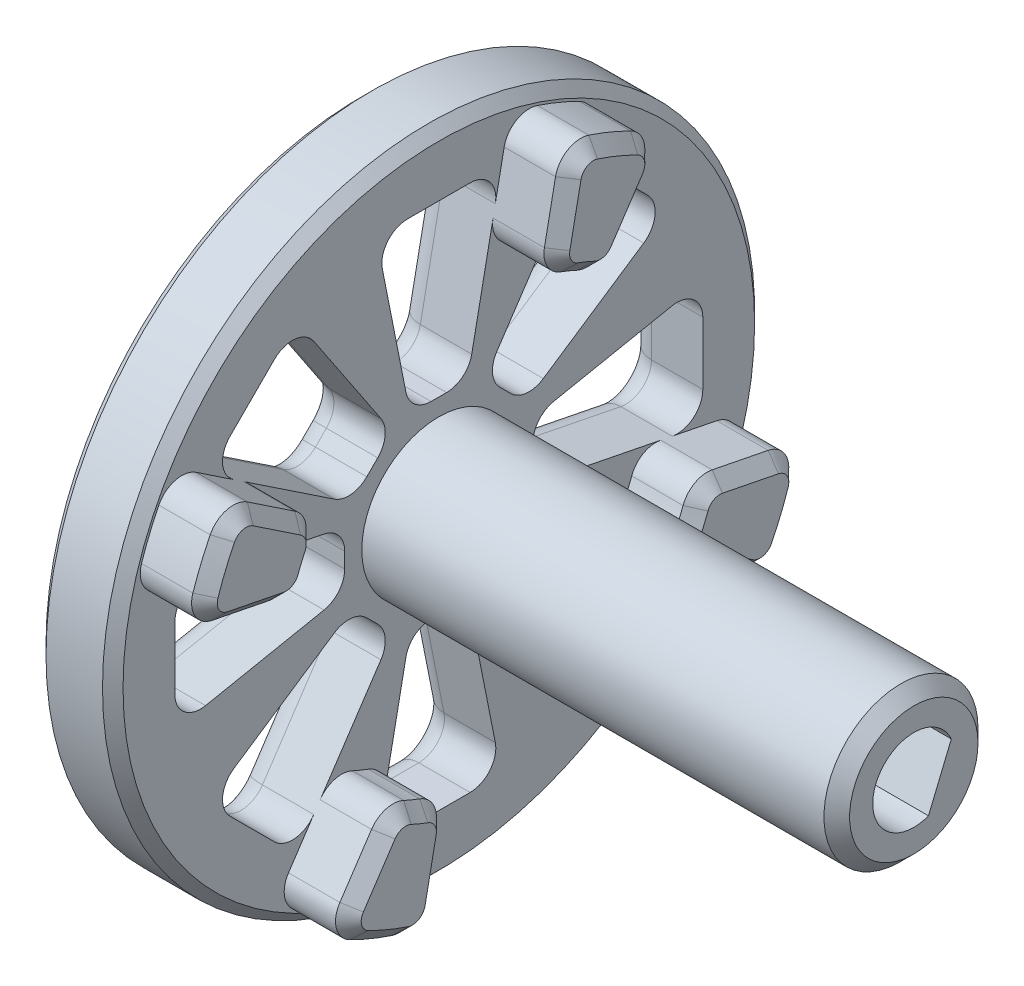
from build123d import *

# Parameters (mm, degrees)
BOSS_EXTRUDE1_DEPTH          = 17.5
BOSS_EXTRUDE1_DEPTH_BACK     = 1.5
SKETCH2_R                    = 3
CUT_EXTRUDE_468_DEPTH        = 10
CHAMFER1_SIZE                = 0.5
SKETCH4_R                    = 12.7
EXTRUDE_692_DEPTH            = 3
CHAMFER2_SIZE                = 0.4
CUT_EXTRUDE6_REACH           = 30.015
CIRPATTERN1_COUNT            = 8
FILLET1_R                    = 1
BOSS_EXTRUDE7_DEPTH          = 2.5
CHAMFER4_SIZE                = 0.5
CIRPATTERN4_COUNT            = 4
CHAMFER4_OF_CIRPATTERN4_SIZE = 0.5


with BuildPart() as part:
    # Sketch2 → Boss-Extrude1 (new, two sides: drawn at the far end of the back side and taken through both)
    with BuildSketch(Plane(origin=(0, 0, 0), x_dir=(0, 0, -1), z_dir=(1, 0, 0)).offset(-BOSS_EXTRUDE1_DEPTH_BACK)):
        Circle(SKETCH2_R)
    extrude(amount=BOSS_EXTRUDE1_DEPTH + BOSS_EXTRUDE1_DEPTH_BACK)

    # Sketch1 → Cut-Extrude 468 (cut)
    with BuildSketch(Plane(origin=(17.5, 0, 0), x_dir=(0, 0, -1), z_dir=(1, 0, 0))):
        with BuildLine():
            Line((1.460905454, 0.652499237), (0.571629518, -1.494402789))
            ThreePointArc((0.571629518, -1.494402789), (-1.478207252, 0.612293492), (1.460905454, 0.652499237))
        make_face()
    extrude(amount=-CUT_EXTRUDE_468_DEPTH, mode=Mode.SUBTRACT)

    # Chamfer1
    chamfer1_edges = [part.edges().sort_by_distance(p)[0] for p in [
        (17.5, 0, 3),
    ]]
    chamfer(chamfer1_edges, length=CHAMFER1_SIZE)

    # Sketch4 → Extrude 692 (add)
    with BuildSketch(Plane.ZY.offset(1)):
        Circle(SKETCH4_R)
    extrude(amount=EXTRUDE_692_DEPTH)

    # Chamfer2
    chamfer2_edges = [part.edges().sort_by_distance(p)[0] for p in [
        (-1, 0, -12.7),
        (-4, 0, -12.7),
    ]]
    chamfer(chamfer2_edges, length=CHAMFER2_SIZE)

    # Sketch6 → Cut-Extrude6 (cut, up to next)
    with BuildSketch(Plane.ZY.offset(4), mode=Mode.PRIVATE) as cut_extrude6_sk1:
        with BuildLine():
            Line((-0.301146321, 3.666270684), (0.301146321, 3.666270684))
            ThreePointArc((0.301146321, 3.666270684), (0.935539605, 3.893260231), (1.281931602, 4.471180362))
            Line((1.281931602, 4.471180362), (2.20002588, 9.086751984))
            ThreePointArc((2.20002588, 9.086751984), (1.992251053, 9.91623559), (1.219240599, 10.281842306))
            Line((1.219240599, 10.281842306), (-1.219240599, 10.281842306))
            ThreePointArc((-1.219240599, 10.281842306), (-1.992251053, 9.91623559), (-2.20002588, 9.086751984))
            Line((-2.20002588, 9.086751984), (-1.281931602, 4.471180362))
            ThreePointArc((-1.281931602, 4.471180362), (-0.935539605, 3.893260231), (-0.301146321, 3.666270684))
        make_face()
    cut_extrude6_tool1 = extrude(cut_extrude6_sk1.sketch, amount=-CUT_EXTRUDE6_REACH, mode=Mode.PRIVATE) & part.part
    cut_extrude6 = cut_extrude6_tool1.solids().sort_by_distance((-4, 7.345701, 0))[0]
    add(cut_extrude6, mode=Mode.SUBTRACT)

    # CirPattern1: Cut-Extrude6 ×8 about axis
    cirpattern1_axis = Axis((0, 0, 0), (1, 0, 0))
    for i in range(1, CIRPATTERN1_COUNT):
        add(cut_extrude6.rotate(cirpattern1_axis, i * 360 / CIRPATTERN1_COUNT), mode=Mode.SUBTRACT)

    # Fillet1
    # the kernel refuses this fillet: 1 mm, written as the material it takes off along each edge
    with BuildSketch(Plane(origin=(-4, -9.281842306, -1.219240599), x_dir=(0, 0.1950903220161297, -0.9807852804032302), z_dir=(0, 0.9807852804032302, 0.1950903220161297))) as fillet1_piece_1:
        with BuildLine():
            CenterArc((1 + FILLET1_R, -FILLET1_R), FILLET1_R, 90, 90)
            Line((1 + FILLET1_R, 0), (1, 0))
            Line((1, 0), (1, -FILLET1_R))
        make_face()
    revolve(axis=Axis((-4, -9.281842306, -1.219240599), (-1, 0, 0)), revolution_arc=101.25, mode=Mode.SUBTRACT)
    with BuildSketch(Plane(origin=(-4, -10.281842306, -1.219240599), x_dir=(1, 0, 0), z_dir=(0, 0, 1)), Plane(origin=(-4, -8.132493713, 6.408227122), x_dir=(1, 0, 0), z_dir=(0, 0.7071067811865476, 0.7071067811865475)), Plane(origin=(-4, 1.219240599, -10.281842306), x_dir=(1, 0, 0), z_dir=(0, -1, 0)), Plane(origin=(-4, -6.408227122, -8.132493713), x_dir=(1, 0, 0), z_dir=(0, -0.7071067811865475, 0.7071067811865477)), Plane(origin=(-4, 6.408227122, 8.132493713), x_dir=(1, 0, 0), z_dir=(0, 0.7071067811865475, -0.7071067811865476)), Plane(origin=(-4, -1.219240599, 10.281842306), x_dir=(1, 0, 0), z_dir=(0, 1, 0)), Plane(origin=(-4, 8.132493713, -6.408227122), x_dir=(1, 0, 0), z_dir=(0, -0.7071067811865477, -0.7071067811865474)), Plane(origin=(-4, 10.281842306, 1.219240599), x_dir=(1, 0, 0), z_dir=(0, 0, -1))) as fillet1_piece_2:
        with BuildLine():
            CenterArc((FILLET1_R, -FILLET1_R), FILLET1_R, 90, 90)
            Line((0, -FILLET1_R), (0, 0))
            Line((0, 0), (FILLET1_R, 0))
        make_face()
    extrude(amount=2.438481198, mode=Mode.SUBTRACT)
    with BuildSketch(Plane(origin=(-4, -9.281842306, 1.219240599), x_dir=(0, -1, 0), z_dir=(0, 0, -1))) as fillet1_piece_3:
        with BuildLine():
            CenterArc((1 + FILLET1_R, -FILLET1_R), FILLET1_R, 90, 90)
            Line((1 + FILLET1_R, 0), (1, 0))
            Line((1, 0), (1, -FILLET1_R))
        make_face()
    revolve(axis=Axis((-4, -9.281842306, 1.219240599), (-1, 0, 0)), revolution_arc=101.25, mode=Mode.SUBTRACT)
    with BuildSketch(Plane(origin=(-4, -9.086751984, 2.20002588), x_dir=(1, 0, 0), z_dir=(0, 0.9807852804032319, -0.19509032201612145)), Plane(origin=(-4, -4.471180362, -1.281931602), x_dir=(1, 0, 0), z_dir=(0, -0.9807852804032319, -0.1950903220161212)), Plane(origin=(-4, -4.869650728, 7.980957165), x_dir=(1, 0, 0), z_dir=(0, 0.5555702330196081, -0.8314696123025413)), Plane(origin=(-4, -4.068064482, 2.255139425), x_dir=(1, 0, 0), z_dir=(0, -0.8314696123025412, 0.5555702330196082)), Plane(origin=(-4, -2.20002588, -9.086751984), x_dir=(1, 0, 0), z_dir=(0, 0.19509032201612156, 0.9807852804032319)), Plane(origin=(-4, 1.281931602, -4.471180362), x_dir=(1, 0, 0), z_dir=(0, 0.1950903220161211, -0.9807852804032319)), Plane(origin=(-4, -7.980957165, -4.869650728), x_dir=(1, 0, 0), z_dir=(0, 0.8314696123025415, 0.555570233019608)), Plane(origin=(-4, -2.255139425, -4.068064482), x_dir=(1, 0, 0), z_dir=(0, -0.5555702330196083, -0.8314696123025412)), Plane(origin=(-4, 7.980957165, 4.869650728), x_dir=(1, 0, 0), z_dir=(0, -0.8314696123025413, -0.5555702330196081)), Plane(origin=(-4, 2.255139425, 4.068064482), x_dir=(1, 0, 0), z_dir=(0, 0.5555702330196082, 0.8314696123025412)), Plane(origin=(-4, 2.20002588, 9.086751984), x_dir=(1, 0, 0), z_dir=(0, -0.19509032201612145, -0.9807852804032319)), Plane(origin=(-4, -1.281931602, 4.471180362), x_dir=(1, 0, 0), z_dir=(0, -0.1950903220161212, 0.9807852804032319)), Plane(origin=(-4, 4.869650728, -7.980957165), x_dir=(1, 0, 0), z_dir=(0, -0.555570233019608, 0.8314696123025415)), Plane(origin=(-4, 4.068064482, -2.255139425), x_dir=(1, 0, 0), z_dir=(0, 0.8314696123025412, -0.5555702330196084)), Plane(origin=(-4, 9.086751984, -2.20002588), x_dir=(1, 0, 0), z_dir=(0, -0.9807852804032319, 0.19509032201612134)), Plane(origin=(-4, 4.471180362, 1.281931602), x_dir=(1, 0, 0), z_dir=(0, 0.9807852804032319, 0.1950903220161213))) as fillet1_piece_4:
        with BuildLine():
            CenterArc((FILLET1_R, -FILLET1_R), FILLET1_R, 90, 90)
            Line((0, -FILLET1_R), (0, 0))
            Line((0, 0), (FILLET1_R, 0))
        make_face()
    extrude(amount=4.705996015, mode=Mode.SUBTRACT)
    with BuildSketch(Plane(origin=(-4, -4.666270684, 0.301146321), x_dir=(0, 0.1950903220161148, 0.9807852804032332), z_dir=(0, -0.9807852804032332, 0.1950903220161148))) as fillet1_piece_5:
        with BuildLine():
            CenterArc((1 + FILLET1_R, -FILLET1_R), FILLET1_R, 90, 90)
            Line((1 + FILLET1_R, 0), (1, 0))
            Line((1, 0), (1, -FILLET1_R))
        make_face()
    revolve(axis=Axis((-4, -4.666270684, 0.301146321), (-1, 0, 0)), revolution_arc=78.75, mode=Mode.SUBTRACT)
    with BuildSketch(Plane(origin=(-4, -3.666270684, 0.301146321), x_dir=(1, 0, 0), z_dir=(0, 0, -1)), Plane(origin=(-4, -2.379502257, 2.805387468), x_dir=(1, 0, 0), z_dir=(0, -0.7071067811865476, -0.7071067811865475)), Plane(origin=(-4, -0.301146321, -3.666270684), x_dir=(1, 0, 0), z_dir=(0, 1, 0)), Plane(origin=(-4, -2.805387468, -2.379502257), x_dir=(1, 0, 0), z_dir=(0, 0.7071067811865475, -0.7071067811865477)), Plane(origin=(-4, 2.805387468, 2.379502257), x_dir=(1, 0, 0), z_dir=(0, -0.7071067811865475, 0.7071067811865476)), Plane(origin=(-4, 0.301146321, 3.666270684), x_dir=(1, 0, 0), z_dir=(0, -1, 0)), Plane(origin=(-4, 2.379502257, -2.805387468), x_dir=(1, 0, 0), z_dir=(0, 0.7071067811865477, 0.7071067811865474)), Plane(origin=(-4, 3.666270684, -0.301146321), x_dir=(1, 0, 0), z_dir=(0, 0, 1))) as fillet1_piece_6:
        with BuildLine():
            CenterArc((FILLET1_R, -FILLET1_R), FILLET1_R, 90, 90)
            Line((0, -FILLET1_R), (0, 0))
            Line((0, 0), (FILLET1_R, 0))
        make_face()
    extrude(amount=0.602292642, mode=Mode.SUBTRACT)
    with BuildSketch(Plane(origin=(-4, -4.666270684, -0.301146321), x_dir=(0, 1, 0), z_dir=(0, 0, 1))) as fillet1_piece_7:
        with BuildLine():
            CenterArc((1 + FILLET1_R, -FILLET1_R), FILLET1_R, 90, 90)
            Line((1 + FILLET1_R, 0), (1, 0))
            Line((1, 0), (1, -FILLET1_R))
        make_face()
    revolve(axis=Axis((-4, -4.666270684, -0.301146321), (-1, 0, 0)), revolution_arc=78.75, mode=Mode.SUBTRACT)
    with BuildSketch(Plane(origin=(-4, -7.425386932, 5.701120341), x_dir=(0, -0.5555702330196015, -0.8314696123025458), z_dir=(0, 0.8314696123025458, -0.5555702330196015))) as fillet1_piece_8:
        with BuildLine():
            CenterArc((1 + FILLET1_R, -FILLET1_R), FILLET1_R, 90, 90)
            Line((1 + FILLET1_R, 0), (1, 0))
            Line((1, 0), (1, -FILLET1_R))
        make_face()
    revolve(axis=Axis((-4, -7.425386932, 5.701120341), (-1, 0, 0)), revolution_arc=101.25, mode=Mode.SUBTRACT)
    with BuildSketch(Plane(origin=(-4, -5.701120341, 7.425386932), x_dir=(0, -0.7071067811865542, 0.7071067811865409), z_dir=(0, -0.7071067811865409, -0.7071067811865542))) as fillet1_piece_9:
        with BuildLine():
            CenterArc((1 + FILLET1_R, -FILLET1_R), FILLET1_R, 90, 90)
            Line((1 + FILLET1_R, 0), (1, 0))
            Line((1, 0), (1, -FILLET1_R))
        make_face()
    revolve(axis=Axis((-4, -5.701120341, 7.425386932), (-1, 0, 0)), revolution_arc=101.25, mode=Mode.SUBTRACT)
    with BuildSketch(Plane(origin=(-4, -3.086609038, 3.512494249), x_dir=(0, 0.8314696123025379, 0.5555702330196132), z_dir=(0, -0.5555702330196132, 0.8314696123025379))) as fillet1_piece_10:
        with BuildLine():
            CenterArc((1 + FILLET1_R, -FILLET1_R), FILLET1_R, 90, 90)
            Line((1 + FILLET1_R, 0), (1, 0))
            Line((1, 0), (1, -FILLET1_R))
        make_face()
    revolve(axis=Axis((-4, -3.086609038, 3.512494249), (-1, 0, 0)), revolution_arc=78.75, mode=Mode.SUBTRACT)
    with BuildSketch(Plane(origin=(-4, -3.512494249, 3.086609038), x_dir=(0, 0.7071067811865516, -0.7071067811865436), z_dir=(0, 0.7071067811865436, 0.7071067811865516))) as fillet1_piece_11:
        with BuildLine():
            CenterArc((1 + FILLET1_R, -FILLET1_R), FILLET1_R, 90, 90)
            Line((1 + FILLET1_R, 0), (1, 0))
            Line((1, 0), (1, -FILLET1_R))
        make_face()
    revolve(axis=Axis((-4, -3.512494249, 3.086609038), (-1, 0, 0)), revolution_arc=78.75, mode=Mode.SUBTRACT)
    with BuildSketch(Plane(origin=(-4, 1.219240599, -9.281842306), x_dir=(0, 0.9807852804032302, 0.19509032201612966), z_dir=(0, -0.19509032201612966, 0.9807852804032302))) as fillet1_piece_12:
        with BuildLine():
            CenterArc((1 + FILLET1_R, -FILLET1_R), FILLET1_R, 90, 90)
            Line((1 + FILLET1_R, 0), (1, 0))
            Line((1, 0), (1, -FILLET1_R))
        make_face()
    revolve(axis=Axis((-4, 1.219240599, -9.281842306), (-1, 0, 0)), revolution_arc=101.25, mode=Mode.SUBTRACT)
    with BuildSketch(Plane(origin=(-4, -1.219240599, -9.281842306), x_dir=(0, 0, -1), z_dir=(0, 1, 0))) as fillet1_piece_13:
        with BuildLine():
            CenterArc((1 + FILLET1_R, -FILLET1_R), FILLET1_R, 90, 90)
            Line((1 + FILLET1_R, 0), (1, 0))
            Line((1, 0), (1, -FILLET1_R))
        make_face()
    revolve(axis=Axis((-4, -1.219240599, -9.281842306), (-1, 0, 0)), revolution_arc=101.25, mode=Mode.SUBTRACT)
    with BuildSketch(Plane(origin=(-4, -0.301146321, -4.666270684), x_dir=(0, -0.9807852804032332, 0.1950903220161148), z_dir=(0, -0.1950903220161148, -0.9807852804032332))) as fillet1_piece_14:
        with BuildLine():
            CenterArc((1 + FILLET1_R, -FILLET1_R), FILLET1_R, 90, 90)
            Line((1 + FILLET1_R, 0), (1, 0))
            Line((1, 0), (1, -FILLET1_R))
        make_face()
    revolve(axis=Axis((-4, -0.301146321, -4.666270684), (-1, 0, 0)), revolution_arc=78.75, mode=Mode.SUBTRACT)
    with BuildSketch(Plane(origin=(-4, 0.301146321, -4.666270684), x_dir=(0, 0, 1), z_dir=(0, -1, 0))) as fillet1_piece_15:
        with BuildLine():
            CenterArc((1 + FILLET1_R, -FILLET1_R), FILLET1_R, 90, 90)
            Line((1 + FILLET1_R, 0), (1, 0))
            Line((1, 0), (1, -FILLET1_R))
        make_face()
    revolve(axis=Axis((-4, 0.301146321, -4.666270684), (-1, 0, 0)), revolution_arc=78.75, mode=Mode.SUBTRACT)
    with BuildSketch(Plane(origin=(-4, -5.701120341, -7.425386932), x_dir=(0, 0.8314696123025458, -0.5555702330196015), z_dir=(0, 0.5555702330196015, 0.8314696123025458))) as fillet1_piece_16:
        with BuildLine():
            CenterArc((1 + FILLET1_R, -FILLET1_R), FILLET1_R, 90, 90)
            Line((1 + FILLET1_R, 0), (1, 0))
            Line((1, 0), (1, -FILLET1_R))
        make_face()
    revolve(axis=Axis((-4, -5.701120341, -7.425386932), (-1, 0, 0)), revolution_arc=101.25, mode=Mode.SUBTRACT)
    with BuildSketch(Plane(origin=(-4, -7.425386932, -5.701120341), x_dir=(0, -0.7071067811865414, -0.7071067811865538), z_dir=(0, 0.7071067811865538, -0.7071067811865414))) as fillet1_piece_17:
        with BuildLine():
            CenterArc((1 + FILLET1_R, -FILLET1_R), FILLET1_R, 90, 90)
            Line((1 + FILLET1_R, 0), (1, 0))
            Line((1, 0), (1, -FILLET1_R))
        make_face()
    revolve(axis=Axis((-4, -7.425386932, -5.701120341), (-1, 0, 0)), revolution_arc=101.25, mode=Mode.SUBTRACT)
    with BuildSketch(Plane(origin=(-4, -3.512494249, -3.086609038), x_dir=(0, -0.5555702330196135, 0.8314696123025377), z_dir=(0, -0.8314696123025377, -0.5555702330196135))) as fillet1_piece_18:
        with BuildLine():
            CenterArc((1 + FILLET1_R, -FILLET1_R), FILLET1_R, 90, 90)
            Line((1 + FILLET1_R, 0), (1, 0))
            Line((1, 0), (1, -FILLET1_R))
        make_face()
    revolve(axis=Axis((-4, -3.512494249, -3.086609038), (-1, 0, 0)), revolution_arc=78.75, mode=Mode.SUBTRACT)
    with BuildSketch(Plane(origin=(-4, -3.086609038, -3.512494249), x_dir=(0, 0.7071067811865436, 0.7071067811865516), z_dir=(0, -0.7071067811865516, 0.7071067811865436))) as fillet1_piece_19:
        with BuildLine():
            CenterArc((1 + FILLET1_R, -FILLET1_R), FILLET1_R, 90, 90)
            Line((1 + FILLET1_R, 0), (1, 0))
            Line((1, 0), (1, -FILLET1_R))
        make_face()
    revolve(axis=Axis((-4, -3.086609038, -3.512494249), (-1, 0, 0)), revolution_arc=78.75, mode=Mode.SUBTRACT)
    with BuildSketch(Plane(origin=(-4, 5.701120341, 7.425386932), x_dir=(0, -0.8314696123025458, 0.5555702330196015), z_dir=(0, -0.5555702330196015, -0.8314696123025458))) as fillet1_piece_20:
        with BuildLine():
            CenterArc((1 + FILLET1_R, -FILLET1_R), FILLET1_R, 90, 90)
            Line((1 + FILLET1_R, 0), (1, 0))
            Line((1, 0), (1, -FILLET1_R))
        make_face()
    revolve(axis=Axis((-4, 5.701120341, 7.425386932), (-1, 0, 0)), revolution_arc=101.25, mode=Mode.SUBTRACT)
    with BuildSketch(Plane(origin=(-4, 7.425386932, 5.701120341), x_dir=(0, 0.7071067811865405, 0.7071067811865547), z_dir=(0, -0.7071067811865547, 0.7071067811865405))) as fillet1_piece_21:
        with BuildLine():
            CenterArc((1 + FILLET1_R, -FILLET1_R), FILLET1_R, 90, 90)
            Line((1 + FILLET1_R, 0), (1, 0))
            Line((1, 0), (1, -FILLET1_R))
        make_face()
    revolve(axis=Axis((-4, 7.425386932, 5.701120341), (-1, 0, 0)), revolution_arc=101.25, mode=Mode.SUBTRACT)
    with BuildSketch(Plane(origin=(-4, 3.512494249, 3.086609038), x_dir=(0, 0.5555702330196135, -0.8314696123025377), z_dir=(0, 0.8314696123025377, 0.5555702330196135))) as fillet1_piece_22:
        with BuildLine():
            CenterArc((1 + FILLET1_R, -FILLET1_R), FILLET1_R, 90, 90)
            Line((1 + FILLET1_R, 0), (1, 0))
            Line((1, 0), (1, -FILLET1_R))
        make_face()
    revolve(axis=Axis((-4, 3.512494249, 3.086609038), (-1, 0, 0)), revolution_arc=78.75, mode=Mode.SUBTRACT)
    with BuildSketch(Plane(origin=(-4, 3.086609038, 3.512494249), x_dir=(0, -0.7071067811865436, -0.7071067811865516), z_dir=(0, 0.7071067811865516, -0.7071067811865436))) as fillet1_piece_23:
        with BuildLine():
            CenterArc((1 + FILLET1_R, -FILLET1_R), FILLET1_R, 90, 90)
            Line((1 + FILLET1_R, 0), (1, 0))
            Line((1, 0), (1, -FILLET1_R))
        make_face()
    revolve(axis=Axis((-4, 3.086609038, 3.512494249), (-1, 0, 0)), revolution_arc=78.75, mode=Mode.SUBTRACT)
    with BuildSketch(Plane(origin=(-4, -1.219240599, 9.281842306), x_dir=(0, -0.9807852804032302, -0.19509032201612958), z_dir=(0, 0.19509032201612958, -0.9807852804032302))) as fillet1_piece_24:
        with BuildLine():
            CenterArc((1 + FILLET1_R, -FILLET1_R), FILLET1_R, 90, 90)
            Line((1 + FILLET1_R, 0), (1, 0))
            Line((1, 0), (1, -FILLET1_R))
        make_face()
    revolve(axis=Axis((-4, -1.219240599, 9.281842306), (-1, 0, 0)), revolution_arc=101.25, mode=Mode.SUBTRACT)
    with BuildSketch(Plane(origin=(-4, 1.219240599, 9.281842306), x_dir=(0, 0, 1), z_dir=(0, -1, 0))) as fillet1_piece_25:
        with BuildLine():
            CenterArc((1 + FILLET1_R, -FILLET1_R), FILLET1_R, 90, 90)
            Line((1 + FILLET1_R, 0), (1, 0))
            Line((1, 0), (1, -FILLET1_R))
        make_face()
    revolve(axis=Axis((-4, 1.219240599, 9.281842306), (-1, 0, 0)), revolution_arc=101.25, mode=Mode.SUBTRACT)
    with BuildSketch(Plane(origin=(-4, 0.301146321, 4.666270684), x_dir=(0, 0.9807852804032332, -0.19509032201611476), z_dir=(0, 0.19509032201611476, 0.9807852804032332))) as fillet1_piece_26:
        with BuildLine():
            CenterArc((1 + FILLET1_R, -FILLET1_R), FILLET1_R, 90, 90)
            Line((1 + FILLET1_R, 0), (1, 0))
            Line((1, 0), (1, -FILLET1_R))
        make_face()
    revolve(axis=Axis((-4, 0.301146321, 4.666270684), (-1, 0, 0)), revolution_arc=78.75, mode=Mode.SUBTRACT)
    with BuildSketch(Plane(origin=(-4, -0.301146321, 4.666270684), x_dir=(0, 0, -1), z_dir=(0, 1, 0))) as fillet1_piece_27:
        with BuildLine():
            CenterArc((1 + FILLET1_R, -FILLET1_R), FILLET1_R, 90, 90)
            Line((1 + FILLET1_R, 0), (1, 0))
            Line((1, 0), (1, -FILLET1_R))
        make_face()
    revolve(axis=Axis((-4, -0.301146321, 4.666270684), (-1, 0, 0)), revolution_arc=78.75, mode=Mode.SUBTRACT)
    with BuildSketch(Plane(origin=(-4, 7.425386932, -5.701120341), x_dir=(0, 0.5555702330196022, 0.8314696123025453), z_dir=(0, -0.8314696123025453, 0.5555702330196022))) as fillet1_piece_28:
        with BuildLine():
            CenterArc((1 + FILLET1_R, -FILLET1_R), FILLET1_R, 90, 90)
            Line((1 + FILLET1_R, 0), (1, 0))
            Line((1, 0), (1, -FILLET1_R))
        make_face()
    revolve(axis=Axis((-4, 7.425386932, -5.701120341), (-1, 0, 0)), revolution_arc=101.25, mode=Mode.SUBTRACT)
    with BuildSketch(Plane(origin=(-4, 5.701120341, -7.425386932), x_dir=(0, 0.7071067811865533, -0.7071067811865418), z_dir=(0, 0.7071067811865418, 0.7071067811865533))) as fillet1_piece_29:
        with BuildLine():
            CenterArc((1 + FILLET1_R, -FILLET1_R), FILLET1_R, 90, 90)
            Line((1 + FILLET1_R, 0), (1, 0))
            Line((1, 0), (1, -FILLET1_R))
        make_face()
    revolve(axis=Axis((-4, 5.701120341, -7.425386932), (-1, 0, 0)), revolution_arc=101.25, mode=Mode.SUBTRACT)
    with BuildSketch(Plane(origin=(-4, 3.086609038, -3.512494249), x_dir=(0, -0.8314696123025378, -0.5555702330196135), z_dir=(0, 0.5555702330196135, -0.8314696123025378))) as fillet1_piece_30:
        with BuildLine():
            CenterArc((1 + FILLET1_R, -FILLET1_R), FILLET1_R, 90, 90)
            Line((1 + FILLET1_R, 0), (1, 0))
            Line((1, 0), (1, -FILLET1_R))
        make_face()
    revolve(axis=Axis((-4, 3.086609038, -3.512494249), (-1, 0, 0)), revolution_arc=78.75, mode=Mode.SUBTRACT)
    with BuildSketch(Plane(origin=(-4, 3.512494249, -3.086609038), x_dir=(0, -0.7071067811865513, 0.7071067811865438), z_dir=(0, -0.7071067811865438, -0.7071067811865513))) as fillet1_piece_31:
        with BuildLine():
            CenterArc((1 + FILLET1_R, -FILLET1_R), FILLET1_R, 90, 90)
            Line((1 + FILLET1_R, 0), (1, 0))
            Line((1, 0), (1, -FILLET1_R))
        make_face()
    revolve(axis=Axis((-4, 3.512494249, -3.086609038), (-1, 0, 0)), revolution_arc=78.75, mode=Mode.SUBTRACT)
    with BuildSketch(Plane(origin=(-4, 9.281842306, 1.219240599), x_dir=(0, -0.1950903220161296, 0.9807852804032302), z_dir=(0, -0.9807852804032302, -0.1950903220161296))) as fillet1_piece_32:
        with BuildLine():
            CenterArc((1 + FILLET1_R, -FILLET1_R), FILLET1_R, 90, 90)
            Line((1 + FILLET1_R, 0), (1, 0))
            Line((1, 0), (1, -FILLET1_R))
        make_face()
    revolve(axis=Axis((-4, 9.281842306, 1.219240599), (-1, 0, 0)), revolution_arc=101.25, mode=Mode.SUBTRACT)
    with BuildSketch(Plane(origin=(-4, 9.281842306, -1.219240599), x_dir=(0, 1, 0), z_dir=(0, 0, 1))) as fillet1_piece_33:
        with BuildLine():
            CenterArc((1 + FILLET1_R, -FILLET1_R), FILLET1_R, 90, 90)
            Line((1 + FILLET1_R, 0), (1, 0))
            Line((1, 0), (1, -FILLET1_R))
        make_face()
    revolve(axis=Axis((-4, 9.281842306, -1.219240599), (-1, 0, 0)), revolution_arc=101.25, mode=Mode.SUBTRACT)
    with BuildSketch(Plane(origin=(-4, 4.666270684, -0.301146321), x_dir=(0, -0.19509032201611476, -0.9807852804032332), z_dir=(0, 0.9807852804032332, -0.19509032201611476))) as fillet1_piece_34:
        with BuildLine():
            CenterArc((1 + FILLET1_R, -FILLET1_R), FILLET1_R, 90, 90)
            Line((1 + FILLET1_R, 0), (1, 0))
            Line((1, 0), (1, -FILLET1_R))
        make_face()
    revolve(axis=Axis((-4, 4.666270684, -0.301146321), (-1, 0, 0)), revolution_arc=78.75, mode=Mode.SUBTRACT)
    with BuildSketch(Plane(origin=(-4, 4.666270684, 0.301146321), x_dir=(0, -1, 0), z_dir=(0, 0, -1))) as fillet1_piece_35:
        with BuildLine():
            CenterArc((1 + FILLET1_R, -FILLET1_R), FILLET1_R, 90, 90)
            Line((1 + FILLET1_R, 0), (1, 0))
            Line((1, 0), (1, -FILLET1_R))
        make_face()
    revolve(axis=Axis((-4, 4.666270684, 0.301146321), (-1, 0, 0)), revolution_arc=78.75, mode=Mode.SUBTRACT)

    # Sketch10 → Boss-Extrude7 (add)
    with BuildSketch(Plane(origin=(-1, 0, 0), x_dir=(0, 0, -1), z_dir=(1, 0, 0))):
        with BuildLine():
            Line((2.545857957, 10.825367246), (2.11251512, 8.646805688))
            ThreePointArc((2.11251512, 8.646805688), (2.221434223, 7.96197118), (2.749600356, 7.512635881))
            ThreePointArc((2.749600356, 7.512635881), (3.061467459, 7.39103626), (3.367974719, 7.256496834))
            ThreePointArc((3.367974719, 7.256496834), (4.05917261, 7.200755016), (4.620441171, 7.607988705))
            Line((4.620441171, 7.607988705), (5.854497163, 9.454884014))
            ThreePointArc((5.854497163, 9.454884014), (5.989843134, 10.265929542), (5.471512153, 10.904244805))
            ThreePointArc((5.471512153, 10.904244805), (4.668737875, 11.271330297), (3.841522098, 11.579408792))
            ThreePointArc((3.841522098, 11.579408792), (3.023649696, 11.494567093), (2.545857957, 10.825367246))
        make_face()
    boss_extrude7 = extrude(amount=BOSS_EXTRUDE7_DEPTH)

    # Chamfer4
    chamfer4_edges = [part.edges().sort_by_distance(p)[0] for p in [
        (1.5, 10.265929542, -5.989843134),
        (1.5, 11.271330297, -4.668737875),
        (1.5, 11.494567093, -3.023649696),
        (1.5, 9.736086467, -2.329186539),
        (1.5, 7.96197118, -2.221434223),
        (1.5, 7.39103626, -3.061467459),
        (1.5, 7.200755016, -4.05917261),
        (1.5, 8.531436359, -5.237469167),
    ]]
    chamfer(chamfer4_edges, length=CHAMFER4_SIZE)

    # CirPattern4: Boss-Extrude7 ×4 about axis
    cirpattern4_axis = Axis((0, 0, 0), (1, 0, 0))
    for i in range(1, CIRPATTERN4_COUNT):
        add(boss_extrude7.rotate(cirpattern4_axis, i * 360 / CIRPATTERN4_COUNT))

    # Chamfer4 of CirPattern4
    chamfer4_of_cirpattern4_edges = [part.edges().sort_by_distance(p)[0] for p in [
        (1.5, 5.989843134, 10.265929542),
        (1.5, 4.668737875, 11.271330297),
        (1.5, 3.023649696, 11.494567093),
        (1.5, 2.329186539, 9.736086467),
        (1.5, 2.221434223, 7.96197118),
        (1.5, 3.061467459, 7.39103626),
        (1.5, 4.05917261, 7.200755016),
        (1.5, 5.237469167, 8.531436359),
        (1.5, -10.265929542, 5.989843134),
        (1.5, -11.271330297, 4.668737875),
        (1.5, -11.494567093, 3.023649696),
        (1.5, -9.736086467, 2.329186539),
        (1.5, -7.96197118, 2.221434223),
        (1.5, -7.39103626, 3.061467459),
        (1.5, -7.200755016, 4.05917261),
        (1.5, -8.531436359, 5.237469167),
        (1.5, -5.989843134, -10.265929542),
        (1.5, -4.668737875, -11.271330297),
        (1.5, -3.023649696, -11.494567093),
        (1.5, -2.329186539, -9.736086467),
        (1.5, -2.221434223, -7.96197118),
        (1.5, -3.061467459, -7.39103626),
        (1.5, -4.05917261, -7.200755016),
        (1.5, -5.237469167, -8.531436359),
    ]]
    chamfer(chamfer4_of_cirpattern4_edges, length=CHAMFER4_OF_CIRPATTERN4_SIZE)


solid = part.part
